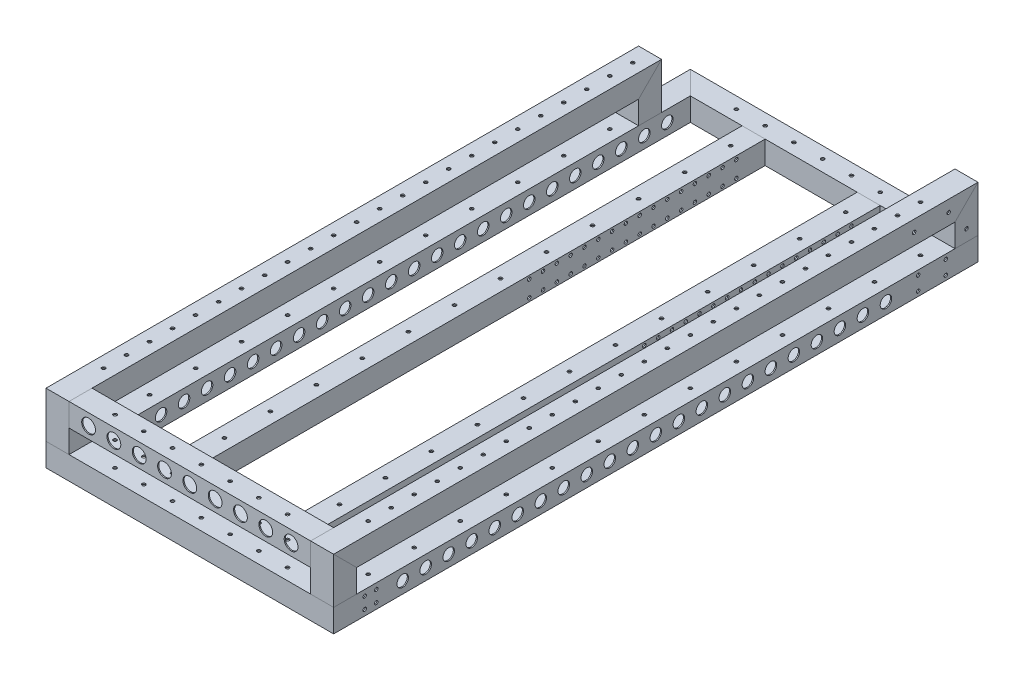
from build123d import *

# Parameters (mm, degrees)
WL_20X20X1_2_DEPTH         = 555.142135624
WL_20X20X1_2_DEPTH_BACK    = 15.142135624
SKETCH_12_W                = 20
SKETCH_12_H                = 20
SKETCH_12_W_2              = 18
SKETCH_12_H_2              = 18
SKETCH_12_ON_SEGMENT_2_W   = 20
SKETCH_12_ON_SEGMENT_2_H   = 20
SKETCH_12_ON_SEGMENT_2_W_2 = 18
SKETCH_12_ON_SEGMENT_2_H_2 = 18
WL_20X20X1_2_2_DEPTH       = 260.284271247
SKETCH_12_ON_SEGMENT_3_W   = 20
SKETCH_12_ON_SEGMENT_3_H   = 20
SKETCH_12_ON_SEGMENT_3_W_2 = 18
SKETCH_12_ON_SEGMENT_3_H_2 = 18
WL_20X20X1_2_3_DEPTH       = 570.284271247
SKETCH_12_ON_SEGMENT_4_W   = 20
SKETCH_12_ON_SEGMENT_4_H   = 20
SKETCH_12_ON_SEGMENT_4_W_2 = 18
SKETCH_12_ON_SEGMENT_4_H_2 = 18
WL_20X20X1_2_4_DEPTH       = 260.284271247
SKETCH_12_ON_SEGMENT_5_W   = 20
SKETCH_12_ON_SEGMENT_5_H   = 20
SKETCH_12_ON_SEGMENT_5_W_2 = 18
SKETCH_12_ON_SEGMENT_5_H_2 = 18
WL_20X20X1_2_5_DEPTH       = 542
SKETCH_12_ON_SEGMENT_6_W   = 20
SKETCH_12_ON_SEGMENT_6_H   = 20
SKETCH_12_ON_SEGMENT_6_W_2 = 18
SKETCH_12_ON_SEGMENT_6_H_2 = 18
WL_20X20X1_2_6_DEPTH       = 542
SKETCH_15_W                = 20
SKETCH_15_H                = 20
SKETCH_15_W_2              = 18
SKETCH_15_H_2              = 18
WL_20X20X1_4_DEPTH         = 45.142135624
SKETCH_15_ON_SEGMENT_2_W   = 20
SKETCH_15_ON_SEGMENT_2_H   = 20
SKETCH_15_ON_SEGMENT_2_W_2 = 18
SKETCH_15_ON_SEGMENT_2_H_2 = 18
WL_20X20X1_4_2_DEPTH       = 525.284271247
SKETCH_15_ON_SEGMENT_3_W   = 20
SKETCH_15_ON_SEGMENT_3_H   = 20
SKETCH_15_ON_SEGMENT_3_W_2 = 18
SKETCH_15_ON_SEGMENT_3_H_2 = 18
WL_20X20X1_4_3_DEPTH       = 45.142135624
SKETCH_15_ON_SEGMENT_4_W   = 20
SKETCH_15_ON_SEGMENT_4_H   = 20
SKETCH_15_ON_SEGMENT_4_W_2 = 18
SKETCH_15_ON_SEGMENT_4_H_2 = 18
WL_20X20X1_4_4_DEPTH       = 45.142135624
SKETCH_15_ON_SEGMENT_5_W   = 20
SKETCH_15_ON_SEGMENT_5_H   = 20
SKETCH_15_ON_SEGMENT_5_W_2 = 18
SKETCH_15_ON_SEGMENT_5_H_2 = 18
WL_20X20X1_4_5_DEPTH       = 570.284271247
SKETCH_15_ON_SEGMENT_6_W   = 20
SKETCH_15_ON_SEGMENT_6_H   = 20
SKETCH_15_ON_SEGMENT_6_W_2 = 18
SKETCH_15_ON_SEGMENT_6_H_2 = 18
WL_20X20X1_4_6_DEPTH       = 45.142135624
SKETCH_17_W                = 20
SKETCH_17_H                = 20
SKETCH_17_W_2              = 18
SKETCH_17_H_2              = 18
WL_20X20X1_5_DEPTH         = 210
SKETCH_18_R                = 1.5
CUT_EXTRUDE_1_DEPTH        = 20
SKETCH_19_R                = 1.5
CUT_EXTRUDE_2_DEPTH        = 20
SKETCH_20_R                = 1.5
CUT_EXTRUDE_3_DEPTH        = 20
SKETCH_21_R                = 1.5
CUT_EXTRUDE_4_DEPTH        = 120
SKETCH_22_R                = 5
CUT_EXTRUDE_5_DEPTH        = 20
SKETCH_23_R                = 5
CUT_EXTRUDE_6_DEPTH        = 20
SKETCH_24_R                = 6
CUT_EXTRUDE_7_DEPTH        = 20
SKETCH_25_R                = 1.5
CUT_EXTRUDE_8_DEPTH        = 20
SKETCH_27_R                = 1.5
CUT_EXTRUDE_9_DEPTH        = 20
SKETCH_28_R                = 1.5
CUT_EXTRUDE_10_DEPTH       = 313.449995999
SKETCH_29_R                = 1.5
CUT_EXTRUDE_11_DEPTH       = 20


with BuildPart() as part:
    # 草图12 → Wl 20X20X1(2) (new, two sides: drawn at the far end of the back side and taken through both)
    with BuildSketch(Plane(origin=(-115, 0, 270), x_dir=(-1, 0, 0), z_dir=(0, 0, -1)).offset(-WL_20X20X1_2_DEPTH_BACK)):
        Rectangle(SKETCH_12_W, SKETCH_12_H)
        Rectangle(SKETCH_12_W_2, SKETCH_12_H_2, mode=Mode.SUBTRACT)
    extrude(amount=WL_20X20X1_2_DEPTH + WL_20X20X1_2_DEPTH_BACK)

    # Wl 20X20X1(2) mitre 1
    split(bisect_by=Plane(origin=(-115, 0, 270), x_dir=(0, -1, 0), z_dir=(-0.707106781, 0, -0.707106781)), keep=Keep.TOP)

    # Wl 20X20X1(2) mitre 2
    split(bisect_by=Plane(origin=(-115, 0, -270), x_dir=(0, -1, 0), z_dir=(-0.707106781, 0, 0.707106781)), keep=Keep.TOP)

    # 草图20 → 切除-拉伸3 (cut)
    with BuildSketch(Plane.ZY.offset(125)):
        with Locations((243, 5)):
            Circle(SKETCH_20_R)
        with Locations((253, 5)):
            Circle(SKETCH_20_R)
        with Locations(Location((243, -5, 0), (0, 0, 180))):
            Circle(SKETCH_20_R)
        with Locations(Location((253, -5, 0), (0, 0, 180))):
            Circle(SKETCH_20_R)
    extrude(amount=-CUT_EXTRUDE_3_DEPTH, mode=Mode.SUBTRACT)

    # 草图23 → 切除-拉伸6 (cut)
    with BuildSketch(Plane.ZY.offset(125)):
        Circle(SKETCH_23_R)
        with Locations((-20, 0)):
            Circle(SKETCH_23_R)
        with Locations((-40, 0)):
            Circle(SKETCH_23_R)
        with Locations((-60, 0)):
            Circle(SKETCH_23_R)
        with Locations((-80, 0)):
            Circle(SKETCH_23_R)
        with Locations((-100, 0)):
            Circle(SKETCH_23_R)
        with Locations((-120, 0)):
            Circle(SKETCH_23_R)
        with Locations((-140, 0)):
            Circle(SKETCH_23_R)
        with Locations((-160, 0)):
            Circle(SKETCH_23_R)
        with Locations((-180, 0)):
            Circle(SKETCH_23_R)
        with Locations((-200, 0)):
            Circle(SKETCH_23_R)
        with Locations((-220, 0)):
            Circle(SKETCH_23_R)
        with Locations((-240, 0)):
            Circle(SKETCH_23_R)
        with Locations(Location((220, 0, 0), (0, 0, 180))):
            Circle(SKETCH_23_R)
        with Locations(Location((200, 0, 0), (0, 0, 180))):
            Circle(SKETCH_23_R)
        with Locations(Location((180, 0, 0), (0, 0, 180))):
            Circle(SKETCH_23_R)
        with Locations(Location((160, 0, 0), (0, 0, 180))):
            Circle(SKETCH_23_R)
        with Locations(Location((140, 0, 0), (0, 0, 180))):
            Circle(SKETCH_23_R)
        with Locations(Location((120, 0, 0), (0, 0, 180))):
            Circle(SKETCH_23_R)
        with Locations(Location((100, 0, 0), (0, 0, 180))):
            Circle(SKETCH_23_R)
        with Locations(Location((80, 0, 0), (0, 0, 180))):
            Circle(SKETCH_23_R)
        with Locations(Location((60, 0, 0), (0, 0, 180))):
            Circle(SKETCH_23_R)
        with Locations(Location((40, 0, 0), (0, 0, 180))):
            Circle(SKETCH_23_R)
        with Locations(Location((20, 0, 0), (0, 0, 180))):
            Circle(SKETCH_23_R)
    extrude(amount=-CUT_EXTRUDE_6_DEPTH, mode=Mode.SUBTRACT)


with BuildPart() as body_2:
    # 草图12 on segment 2 (carried to segment 2) → Wl 20X20X1_2 2 (new body)
    with BuildSketch(Plane(origin=(-130.142135624, 0, -270), x_dir=(0, 0, -1), z_dir=(1, 0, 0))):
        Rectangle(SKETCH_12_ON_SEGMENT_2_W, SKETCH_12_ON_SEGMENT_2_H)
        Rectangle(SKETCH_12_ON_SEGMENT_2_W_2, SKETCH_12_ON_SEGMENT_2_H_2, mode=Mode.SUBTRACT)
    extrude(amount=WL_20X20X1_2_2_DEPTH)

    # Wl 20X20X1_2 2 mitre 1
    split(bisect_by=Plane(origin=(-115, 0, -270), x_dir=(0, 1, 0), z_dir=(0.707106781, 0, -0.707106781)), keep=Keep.TOP)

    # Wl 20X20X1_2 2 mitre 2
    split(bisect_by=Plane(origin=(115, 0, -270), x_dir=(0, -1, 0), z_dir=(-0.707106781, 0, -0.707106781)), keep=Keep.TOP)


with BuildPart() as body_3:
    # 草图12 on segment 3 (carried to segment 3) → Wl 20X20X1_2 3 (new body)
    with BuildSketch(Plane(origin=(115, 0, -285.142135624), x_dir=(1, 0, 0), z_dir=(0, 0, 1))):
        Rectangle(SKETCH_12_ON_SEGMENT_3_W, SKETCH_12_ON_SEGMENT_3_H)
        Rectangle(SKETCH_12_ON_SEGMENT_3_W_2, SKETCH_12_ON_SEGMENT_3_H_2, mode=Mode.SUBTRACT)
    extrude(amount=WL_20X20X1_2_3_DEPTH)

    # Wl 20X20X1_2 3 mitre 1
    split(bisect_by=Plane(origin=(115, 0, 270), x_dir=(0, 1, 0), z_dir=(0.707106781, 0, -0.707106781)), keep=Keep.TOP)

    # Wl 20X20X1_2 3 mitre 2
    split(bisect_by=Plane(origin=(115, 0, -270), x_dir=(0, 1, 0), z_dir=(0.707106781, 0, 0.707106781)), keep=Keep.TOP)

    # 草图19 → 切除-拉伸2 (cut)
    with BuildSketch(Plane(origin=(125, 0, 0), x_dir=(0, 0, -1), z_dir=(1, 0, 0))):
        with Locations((-253, 5)):
            Circle(SKETCH_19_R)
        with Locations((-243, 5)):
            Circle(SKETCH_19_R)
        with Locations(Location((-243, -5, 0), (0, 0, 180))):
            Circle(SKETCH_19_R)
        with Locations(Location((-253, -5, 0), (0, 0, 180))):
            Circle(SKETCH_19_R)
    extrude(amount=-CUT_EXTRUDE_2_DEPTH, mode=Mode.SUBTRACT)

    # 草图22 → 切除-拉伸5 (cut)
    with BuildSketch(Plane(origin=(125, 0, 0), x_dir=(0, 0, -1), z_dir=(1, 0, 0))):
        Circle(SKETCH_22_R)
        with Locations((20, 0)):
            Circle(SKETCH_22_R)
        with Locations((40, 0)):
            Circle(SKETCH_22_R)
        with Locations((60, 0)):
            Circle(SKETCH_22_R)
        with Locations((80, 0)):
            Circle(SKETCH_22_R)
        with Locations((100, 0)):
            Circle(SKETCH_22_R)
        with Locations((120, 0)):
            Circle(SKETCH_22_R)
        with Locations((140, 0)):
            Circle(SKETCH_22_R)
        with Locations((160, 0)):
            Circle(SKETCH_22_R)
        with Locations((180, 0)):
            Circle(SKETCH_22_R)
        with Locations((200, 0)):
            Circle(SKETCH_22_R)
        with Locations(Location((-220, 0, 0), (0, 0, 180))):
            Circle(SKETCH_22_R)
        with Locations(Location((-200, 0, 0), (0, 0, 180))):
            Circle(SKETCH_22_R)
        with Locations(Location((-180, 0, 0), (0, 0, 180))):
            Circle(SKETCH_22_R)
        with Locations(Location((-160, 0, 0), (0, 0, 180))):
            Circle(SKETCH_22_R)
        with Locations(Location((-140, 0, 0), (0, 0, 180))):
            Circle(SKETCH_22_R)
        with Locations(Location((-120, 0, 0), (0, 0, 180))):
            Circle(SKETCH_22_R)
        with Locations(Location((-100, 0, 0), (0, 0, 180))):
            Circle(SKETCH_22_R)
        with Locations(Location((-80, 0, 0), (0, 0, 180))):
            Circle(SKETCH_22_R)
        with Locations(Location((-60, 0, 0), (0, 0, 180))):
            Circle(SKETCH_22_R)
        with Locations(Location((-40, 0, 0), (0, 0, 180))):
            Circle(SKETCH_22_R)
        with Locations(Location((-20, 0, 0), (0, 0, 180))):
            Circle(SKETCH_22_R)
    extrude(amount=-CUT_EXTRUDE_5_DEPTH, mode=Mode.SUBTRACT)

    # 草图27 → 切除-拉伸9 (cut)
    with BuildSketch(Plane(origin=(125, 0, 0), x_dir=(0, 0, -1), z_dir=(1, 0, 0))):
        with Locations((252, 6)):
            Circle(SKETCH_27_R)
        with Locations((228, 6)):
            Circle(SKETCH_27_R)
        with Locations(Location((228, -6, 0), (0, 0, 180))):
            Circle(SKETCH_27_R)
        with Locations(Location((252, -6, 0), (0, 0, 180))):
            Circle(SKETCH_27_R)
    extrude(amount=-CUT_EXTRUDE_9_DEPTH, mode=Mode.SUBTRACT)


with BuildPart() as body_4:
    # 草图12 on segment 4 (carried to segment 4) → Wl 20X20X1_2 4 (new body)
    with BuildSketch(Plane(origin=(130.142135624, 0, 270), x_dir=(0, 0, 1), z_dir=(-1, 0, 0))):
        Rectangle(SKETCH_12_ON_SEGMENT_4_W, SKETCH_12_ON_SEGMENT_4_H)
        Rectangle(SKETCH_12_ON_SEGMENT_4_W_2, SKETCH_12_ON_SEGMENT_4_H_2, mode=Mode.SUBTRACT)
    extrude(amount=WL_20X20X1_2_4_DEPTH)

    # Wl 20X20X1_2 4 mitre 1
    split(bisect_by=Plane(origin=(-115, 0, 270), x_dir=(0, 1, 0), z_dir=(0.707106781, 0, 0.707106781)), keep=Keep.TOP)

    # Wl 20X20X1_2 4 mitre 2
    split(bisect_by=Plane(origin=(115, 0, 270), x_dir=(0, -1, 0), z_dir=(-0.707106781, 0, 0.707106781)), keep=Keep.TOP)


with BuildPart() as body_5:
    # 草图12 on segment 5 (carried to segment 5) → Wl 20X20X1_2 5 (new body)
    with BuildSketch(Plane(origin=(-50, 0, -271), x_dir=(1, 0, 0), z_dir=(0, 0, 1))):
        Rectangle(SKETCH_12_ON_SEGMENT_5_W, SKETCH_12_ON_SEGMENT_5_H)
        Rectangle(SKETCH_12_ON_SEGMENT_5_W_2, SKETCH_12_ON_SEGMENT_5_H_2, mode=Mode.SUBTRACT)
    extrude(amount=WL_20X20X1_2_5_DEPTH)

    # Wl 20X20X1_2 5 mitre 1
    split(bisect_by=Plane(origin=(-50, 0, -260), x_dir=(0, -1, 0), z_dir=(0, 0, 1)), keep=Keep.TOP)

    # Wl 20X20X1_2 5 mitre 2
    split(bisect_by=Plane(origin=(-50, 0, 260), x_dir=(0, 1, 0), z_dir=(0, 0, -1)), keep=Keep.TOP)


with BuildPart() as body_6:
    # 草图12 on segment 6 (carried to segment 6) → Wl 20X20X1_2 6 (new body)
    with BuildSketch(Plane(origin=(50, 0, -271), x_dir=(1, 0, 0), z_dir=(0, 0, 1))):
        Rectangle(SKETCH_12_ON_SEGMENT_6_W, SKETCH_12_ON_SEGMENT_6_H)
        Rectangle(SKETCH_12_ON_SEGMENT_6_W_2, SKETCH_12_ON_SEGMENT_6_H_2, mode=Mode.SUBTRACT)
    extrude(amount=WL_20X20X1_2_6_DEPTH)

    # Wl 20X20X1_2 6 mitre 1
    split(bisect_by=Plane(origin=(50, 0, -260), x_dir=(0, -1, 0), z_dir=(0, 0, 1)), keep=Keep.TOP)

    # Wl 20X20X1_2 6 mitre 2
    split(bisect_by=Plane(origin=(50, 0, 260), x_dir=(0, 1, 0), z_dir=(0, 0, -1)), keep=Keep.TOP)


with BuildPart() as body_7:
    # 草图15 → Wl 20X20X1(4) (new body)
    with BuildSketch(Plane(origin=(-115, 10, 270), x_dir=(0, 0, 1), z_dir=(0, 1, 0))):
        Rectangle(SKETCH_15_W, SKETCH_15_H)
        Rectangle(SKETCH_15_W_2, SKETCH_15_H_2, mode=Mode.SUBTRACT)
    extrude(amount=WL_20X20X1_4_DEPTH)

    # Wl 20X20X1(4) mitre 1
    split(bisect_by=Plane(origin=(-115, 40, 270), x_dir=(1, 0, 0), z_dir=(0, -0.707106781, 0.707106781)), keep=Keep.TOP)


with BuildPart() as body_8:
    # 草图15 on segment 2 (carried to segment 2) → Wl 20X20X1_4 2 (new body)
    with BuildSketch(Plane(origin=(-115, 40, 285.142135624), x_dir=(0, 1, 0), z_dir=(0, 0, -1))):
        Rectangle(SKETCH_15_ON_SEGMENT_2_W, SKETCH_15_ON_SEGMENT_2_H)
        Rectangle(SKETCH_15_ON_SEGMENT_2_W_2, SKETCH_15_ON_SEGMENT_2_H_2, mode=Mode.SUBTRACT)
    extrude(amount=WL_20X20X1_4_2_DEPTH)

    # Wl 20X20X1_4 2 mitre 1
    split(bisect_by=Plane(origin=(-115, 40, -225), x_dir=(-1, 0, 0), z_dir=(0, 0.707106781, 0.707106781)), keep=Keep.TOP)

    # Wl 20X20X1_4 2 mitre 2
    split(bisect_by=Plane(origin=(-115, 40, 270), x_dir=(-1, 0, 0), z_dir=(0, 0.707106781, -0.707106781)), keep=Keep.TOP)


with BuildPart() as body_9:
    # 草图15 on segment 3 (carried to segment 3) → Wl 20X20X1_4 3 (new body)
    with BuildSketch(Plane(origin=(-115, 55.142135624, -225), x_dir=(0, 0, -1), z_dir=(0, -1, 0))):
        Rectangle(SKETCH_15_ON_SEGMENT_3_W, SKETCH_15_ON_SEGMENT_3_H)
        Rectangle(SKETCH_15_ON_SEGMENT_3_W_2, SKETCH_15_ON_SEGMENT_3_H_2, mode=Mode.SUBTRACT)
    extrude(amount=WL_20X20X1_4_3_DEPTH)

    # Wl 20X20X1_4 3 mitre 1
    split(bisect_by=Plane(origin=(-115, 40, -225), x_dir=(1, 0, 0), z_dir=(0, -0.707106781, -0.707106781)), keep=Keep.TOP)


with BuildPart() as body_10:
    # 草图15 on segment 4 (carried to segment 4) → Wl 20X20X1_4 4 (new body)
    with BuildSketch(Plane(origin=(115, 10, 270), x_dir=(0, 0, 1), z_dir=(0, 1, 0))):
        Rectangle(SKETCH_15_ON_SEGMENT_4_W, SKETCH_15_ON_SEGMENT_4_H)
        Rectangle(SKETCH_15_ON_SEGMENT_4_W_2, SKETCH_15_ON_SEGMENT_4_H_2, mode=Mode.SUBTRACT)
    extrude(amount=WL_20X20X1_4_4_DEPTH)

    # Wl 20X20X1_4 4 mitre 1
    split(bisect_by=Plane(origin=(115, 40, 270), x_dir=(1, 0, 0), z_dir=(0, -0.707106781, 0.707106781)), keep=Keep.TOP)


with BuildPart() as body_11:
    # 草图15 on segment 5 (carried to segment 5) → Wl 20X20X1_4 5 (new body)
    with BuildSketch(Plane(origin=(115, 40, -285.142135624), x_dir=(0, -1, 0), z_dir=(0, 0, 1))):
        Rectangle(SKETCH_15_ON_SEGMENT_5_W, SKETCH_15_ON_SEGMENT_5_H)
        Rectangle(SKETCH_15_ON_SEGMENT_5_W_2, SKETCH_15_ON_SEGMENT_5_H_2, mode=Mode.SUBTRACT)
    extrude(amount=WL_20X20X1_4_5_DEPTH)

    # Wl 20X20X1_4 5 mitre 1
    split(bisect_by=Plane(origin=(115, 40, -270), x_dir=(-1, 0, 0), z_dir=(0, 0.707106781, 0.707106781)), keep=Keep.TOP)

    # Wl 20X20X1_4 5 mitre 2
    split(bisect_by=Plane(origin=(115, 40, 270), x_dir=(-1, 0, 0), z_dir=(0, 0.707106781, -0.707106781)), keep=Keep.TOP)


with BuildPart() as body_12:
    # 草图15 on segment 6 (carried to segment 6) → Wl 20X20X1_4 6 (new body)
    with BuildSketch(Plane(origin=(115, 10, -270), x_dir=(0, 0, 1), z_dir=(0, 1, 0))):
        Rectangle(SKETCH_15_ON_SEGMENT_6_W, SKETCH_15_ON_SEGMENT_6_H)
        Rectangle(SKETCH_15_ON_SEGMENT_6_W_2, SKETCH_15_ON_SEGMENT_6_H_2, mode=Mode.SUBTRACT)
    extrude(amount=WL_20X20X1_4_6_DEPTH)

    # Wl 20X20X1_4 6 mitre 1
    split(bisect_by=Plane(origin=(115, 40, -270), x_dir=(1, 0, 0), z_dir=(0, -0.707106781, -0.707106781)), keep=Keep.TOP)


with BuildPart() as body_13:
    # 草图17 → Wl 20X20X1(5) (new body)
    with BuildSketch(Plane(origin=(-105, 40, 270), x_dir=(0, 0, -1), z_dir=(1, 0, 0))):
        Rectangle(SKETCH_17_W, SKETCH_17_H)
        Rectangle(SKETCH_17_W_2, SKETCH_17_H_2, mode=Mode.SUBTRACT)
    extrude(amount=WL_20X20X1_5_DEPTH)

    # 草图24 → 切除-拉伸7 (cut)
    with BuildSketch(Plane.XY.offset(280)):
        with Locations((0, 40)):
            Circle(SKETCH_24_R)
        with Locations((22, 40)):
            Circle(SKETCH_24_R)
        with Locations((44, 40)):
            Circle(SKETCH_24_R)
        with Locations((66, 40)):
            Circle(SKETCH_24_R)
        with Locations((88, 40)):
            Circle(SKETCH_24_R)
        with Locations((-88, 40)):
            Circle(SKETCH_24_R)
        with Locations((-66, 40)):
            Circle(SKETCH_24_R)
        with Locations((-44, 40)):
            Circle(SKETCH_24_R)
        with Locations((-22, 40)):
            Circle(SKETCH_24_R)
    extrude(amount=-CUT_EXTRUDE_7_DEPTH, mode=Mode.SUBTRACT)


with BuildPart() as cut_extrude_1_tool:
    # 草图18 → 切除-拉伸1 (new body)
    with BuildSketch(Plane(origin=(0, 50, 0), x_dir=(1, 0, 0), z_dir=(0, 1, 0))):
        with Locations(Location((115, -240, 0), (0, 0, 270))):
            Circle(SKETCH_18_R)
        with Locations(Location((115, -220, 0), (0, 0, 270))):
            Circle(SKETCH_18_R)
        with Locations(Location((115, -200, 0), (0, 0, 270))):
            Circle(SKETCH_18_R)
        with Locations(Location((115, -180, 0), (0, 0, 270))):
            Circle(SKETCH_18_R)
        with Locations(Location((115, -160, 0), (0, 0, 270))):
            Circle(SKETCH_18_R)
        with Locations(Location((115, -140, 0), (0, 0, 270))):
            Circle(SKETCH_18_R)
        with Locations(Location((115, -120, 0), (0, 0, 270))):
            Circle(SKETCH_18_R)
        with Locations(Location((115, -100, 0), (0, 0, 270))):
            Circle(SKETCH_18_R)
        with Locations(Location((115, -80, 0), (0, 0, 270))):
            Circle(SKETCH_18_R)
        with Locations(Location((115, -60, 0), (0, 0, 270))):
            Circle(SKETCH_18_R)
        with Locations(Location((115, -40, 0), (0, 0, 270))):
            Circle(SKETCH_18_R)
        with Locations(Location((115, -20, 0), (0, 0, 270))):
            Circle(SKETCH_18_R)
        with Locations(Location((115, 0, 0), (0, 0, 270))):
            Circle(SKETCH_18_R)
        with Locations(Location((115, 20, 0), (0, 0, 270))):
            Circle(SKETCH_18_R)
        with Locations(Location((115, 40, 0), (0, 0, 270))):
            Circle(SKETCH_18_R)
        with Locations(Location((115, 60, 0), (0, 0, 270))):
            Circle(SKETCH_18_R)
        with Locations(Location((115, 80, 0), (0, 0, 270))):
            Circle(SKETCH_18_R)
        with Locations(Location((115, 100, 0), (0, 0, 270))):
            Circle(SKETCH_18_R)
        with Locations(Location((115, 120, 0), (0, 0, 270))):
            Circle(SKETCH_18_R)
        with Locations(Location((115, 140, 0), (0, 0, 270))):
            Circle(SKETCH_18_R)
        with Locations(Location((115, 160, 0), (0, 0, 270))):
            Circle(SKETCH_18_R)
        with Locations(Location((115, 180, 0), (0, 0, 270))):
            Circle(SKETCH_18_R)
        with Locations(Location((115, 200, 0), (0, 0, 270))):
            Circle(SKETCH_18_R)
        with Locations(Location((115, 220, 0), (0, 0, 270))):
            Circle(SKETCH_18_R)
        with Locations(Location((115, 240, 0), (0, 0, 270))):
            Circle(SKETCH_18_R)
        with Locations((-115, 240)):
            Circle(SKETCH_18_R)
        with Locations(Location((-115, 220, 0), (0, 0, 90))):
            Circle(SKETCH_18_R)
        with Locations(Location((-115, 200, 0), (0, 0, 90))):
            Circle(SKETCH_18_R)
        with Locations(Location((-115, 180, 0), (0, 0, 90))):
            Circle(SKETCH_18_R)
        with Locations(Location((-115, 160, 0), (0, 0, 90))):
            Circle(SKETCH_18_R)
        with Locations(Location((-115, 140, 0), (0, 0, 90))):
            Circle(SKETCH_18_R)
        with Locations(Location((-115, 120, 0), (0, 0, 90))):
            Circle(SKETCH_18_R)
        with Locations(Location((-115, 100, 0), (0, 0, 90))):
            Circle(SKETCH_18_R)
        with Locations(Location((-115, 80, 0), (0, 0, 90))):
            Circle(SKETCH_18_R)
        with Locations(Location((-115, 60, 0), (0, 0, 90))):
            Circle(SKETCH_18_R)
        with Locations(Location((-115, 40, 0), (0, 0, 90))):
            Circle(SKETCH_18_R)
        with Locations(Location((-115, 20, 0), (0, 0, 90))):
            Circle(SKETCH_18_R)
        with Locations(Location((-115, 0, 0), (0, 0, 90))):
            Circle(SKETCH_18_R)
        with Locations(Location((-115, -20, 0), (0, 0, 90))):
            Circle(SKETCH_18_R)
        with Locations(Location((-115, -40, 0), (0, 0, 90))):
            Circle(SKETCH_18_R)
        with Locations(Location((-115, -60, 0), (0, 0, 90))):
            Circle(SKETCH_18_R)
        with Locations(Location((-115, -80, 0), (0, 0, 90))):
            Circle(SKETCH_18_R)
        with Locations(Location((-115, -100, 0), (0, 0, 90))):
            Circle(SKETCH_18_R)
        with Locations(Location((-115, -120, 0), (0, 0, 90))):
            Circle(SKETCH_18_R)
        with Locations(Location((-115, -140, 0), (0, 0, 90))):
            Circle(SKETCH_18_R)
        with Locations(Location((-115, -160, 0), (0, 0, 90))):
            Circle(SKETCH_18_R)
        with Locations(Location((-115, -180, 0), (0, 0, 90))):
            Circle(SKETCH_18_R)
        with Locations(Location((-115, -200, 0), (0, 0, 90))):
            Circle(SKETCH_18_R)
        with Locations(Location((-115, -220, 0), (0, 0, 90))):
            Circle(SKETCH_18_R)
        with Locations(Location((-115, -240, 0), (0, 0, 90))):
            Circle(SKETCH_18_R)
    extrude(amount=-CUT_EXTRUDE_1_DEPTH)


with BuildPart() as body_8_1:
    add(body_8.part)

    # 切除-拉伸1: cut by cut_extrude_1_tool
    add(cut_extrude_1_tool.part, mode=Mode.SUBTRACT)


with BuildPart() as body_11_1:
    add(body_11.part)

    # 切除-拉伸1: cut by cut_extrude_1_tool
    add(cut_extrude_1_tool.part, mode=Mode.SUBTRACT)


with BuildPart() as cut_extrude_4_tool:
    # 草图21 → 切除-拉伸4 (new body)
    with BuildSketch(Plane(origin=(60, 0, 0), x_dir=(0, 0, -1), z_dir=(1, 0, 0))):
        with Locations(Location((175, 7, 0), (0, 0, 180))):
            Circle(SKETCH_21_R)
        with Locations(Location((187, 7, 0), (0, 0, 180))):
            Circle(SKETCH_21_R)
        with Locations(Location((175, -7, 0), (0, 0, 180))):
            Circle(SKETCH_21_R)
        with Locations(Location((187, -7, 0), (0, 0, 180))):
            Circle(SKETCH_21_R)
        with Locations(Location((151, 7, 0), (0, 0, 180))):
            Circle(SKETCH_21_R)
        with Locations(Location((163, 7, 0), (0, 0, 180))):
            Circle(SKETCH_21_R)
        with Locations(Location((151, -7, 0), (0, 0, 180))):
            Circle(SKETCH_21_R)
        with Locations(Location((163, -7, 0), (0, 0, 180))):
            Circle(SKETCH_21_R)
        with Locations(Location((127, 7, 0), (0, 0, 180))):
            Circle(SKETCH_21_R)
        with Locations(Location((139, 7, 0), (0, 0, 180))):
            Circle(SKETCH_21_R)
        with Locations(Location((127, -7, 0), (0, 0, 180))):
            Circle(SKETCH_21_R)
        with Locations(Location((139, -7, 0), (0, 0, 180))):
            Circle(SKETCH_21_R)
        with Locations(Location((103, 7, 0), (0, 0, 180))):
            Circle(SKETCH_21_R)
        with Locations(Location((115, 7, 0), (0, 0, 180))):
            Circle(SKETCH_21_R)
        with Locations(Location((103, -7, 0), (0, 0, 180))):
            Circle(SKETCH_21_R)
        with Locations(Location((115, -7, 0), (0, 0, 180))):
            Circle(SKETCH_21_R)
        with Locations(Location((79, 7, 0), (0, 0, 180))):
            Circle(SKETCH_21_R)
        with Locations(Location((91, 7, 0), (0, 0, 180))):
            Circle(SKETCH_21_R)
        with Locations(Location((79, -7, 0), (0, 0, 180))):
            Circle(SKETCH_21_R)
        with Locations(Location((91, -7, 0), (0, 0, 180))):
            Circle(SKETCH_21_R)
        with Locations(Location((55, 7, 0), (0, 0, 180))):
            Circle(SKETCH_21_R)
        with Locations(Location((67, 7, 0), (0, 0, 180))):
            Circle(SKETCH_21_R)
        with Locations(Location((55, -7, 0), (0, 0, 180))):
            Circle(SKETCH_21_R)
        with Locations(Location((67, -7, 0), (0, 0, 180))):
            Circle(SKETCH_21_R)
        with Locations(Location((199, 7, 0), (0, 0, 180))):
            Circle(SKETCH_21_R)
        with Locations(Location((211, 7, 0), (0, 0, 180))):
            Circle(SKETCH_21_R)
        with Locations(Location((199, -7, 0), (0, 0, 180))):
            Circle(SKETCH_21_R)
        with Locations(Location((211, -7, 0), (0, 0, 180))):
            Circle(SKETCH_21_R)
        with Locations(Location((223, 7, 0), (0, 0, 180))):
            Circle(SKETCH_21_R)
        with Locations(Location((235, 7, 0), (0, 0, 180))):
            Circle(SKETCH_21_R)
        with Locations(Location((223, -7, 0), (0, 0, 180))):
            Circle(SKETCH_21_R)
        with Locations(Location((235, -7, 0), (0, 0, 180))):
            Circle(SKETCH_21_R)
    extrude(amount=-CUT_EXTRUDE_4_DEPTH)


with BuildPart() as body_5_1:
    add(body_5.part)

    # 切除-拉伸4: cut by cut_extrude_4_tool
    add(cut_extrude_4_tool.part, mode=Mode.SUBTRACT)


with BuildPart() as body_6_1:
    add(body_6.part)

    # 切除-拉伸4: cut by cut_extrude_4_tool
    add(cut_extrude_4_tool.part, mode=Mode.SUBTRACT)


with BuildPart() as cut_extrude_8_tool:
    # 草图25 → 切除-拉伸8 (new body)
    with BuildSketch(Plane(origin=(125, 0, 0), x_dir=(0, 0, -1), z_dir=(1, 0, 0))):
        with Locations((254.5, 40)):
            Circle(SKETCH_25_R)
        with Locations((270, 20)):
            Circle(SKETCH_25_R)
        with Locations((224.5, 40)):
            Circle(SKETCH_25_R)
    extrude(amount=-CUT_EXTRUDE_8_DEPTH)


with BuildPart() as body_11_2:
    add(body_11_1.part)

    # 切除-拉伸8: cut by cut_extrude_8_tool
    add(cut_extrude_8_tool.part, mode=Mode.SUBTRACT)


with BuildPart() as body_12_1:
    add(body_12.part)

    # 切除-拉伸8: cut by cut_extrude_8_tool
    add(cut_extrude_8_tool.part, mode=Mode.SUBTRACT)


with BuildPart() as cut_extrude_10_tool:
    # 草图28 → 切除-拉伸10 (new, through all)
    with BuildSketch(Plane(origin=(0, 50, 0), x_dir=(1, 0, 0), z_dir=(0, 1, 0))):
        with Locations(Location((0, -270, 0), (0, 0, 270))):
            Circle(SKETCH_28_R)
        with Locations(Location((25, -270, 0), (0, 0, 270))):
            Circle(SKETCH_28_R)
        with Locations(Location((50, -270, 0), (0, 0, 270))):
            Circle(SKETCH_28_R)
        with Locations(Location((75, -270, 0), (0, 0, 270))):
            Circle(SKETCH_28_R)
        with Locations(Location((-75, -270, 0), (0, 0, 270))):
            Circle(SKETCH_28_R)
        with Locations(Location((-50, -270, 0), (0, 0, 270))):
            Circle(SKETCH_28_R)
        with Locations(Location((-25, -270, 0), (0, 0, 270))):
            Circle(SKETCH_28_R)
    extrude(amount=-CUT_EXTRUDE_10_DEPTH)


with BuildPart() as body_4_1:
    add(body_4.part)

    # 切除-拉伸10: cut by cut_extrude_10_tool
    add(cut_extrude_10_tool.part, mode=Mode.SUBTRACT)


with BuildPart() as body_13_1:
    add(body_13.part)

    # 切除-拉伸10: cut by cut_extrude_10_tool
    add(cut_extrude_10_tool.part, mode=Mode.SUBTRACT)


with BuildPart() as cut_extrude_11_tool:
    # 草图29 → 切除-拉伸11 (new body)
    with BuildSketch(Plane.XZ.offset(10)):
        with Locations(Location((50, 0, 0), (0, 0, 270))):
            Circle(SKETCH_29_R)
        with Locations(Location((50, 40, 0), (0, 0, 270))):
            Circle(SKETCH_29_R)
        with Locations(Location((50, 80, 0), (0, 0, 270))):
            Circle(SKETCH_29_R)
        with Locations(Location((50, 120, 0), (0, 0, 270))):
            Circle(SKETCH_29_R)
        with Locations(Location((50, 160, 0), (0, 0, 270))):
            Circle(SKETCH_29_R)
        with Locations(Location((50, 200, 0), (0, 0, 270))):
            Circle(SKETCH_29_R)
        with Locations(Location((50, 240, 0), (0, 0, 270))):
            Circle(SKETCH_29_R)
        with Locations(Location((50, -240, 0), (0, 0, 90))):
            Circle(SKETCH_29_R)
        with Locations(Location((50, -200, 0), (0, 0, 90))):
            Circle(SKETCH_29_R)
        with Locations(Location((50, -160, 0), (0, 0, 90))):
            Circle(SKETCH_29_R)
        with Locations(Location((50, -120, 0), (0, 0, 90))):
            Circle(SKETCH_29_R)
        with Locations(Location((50, -80, 0), (0, 0, 90))):
            Circle(SKETCH_29_R)
        with Locations(Location((50, -40, 0), (0, 0, 90))):
            Circle(SKETCH_29_R)
        with Locations(Location((-50, -40, 0), (0, 0, 270))):
            Circle(SKETCH_29_R)
        with Locations(Location((-50, -80, 0), (0, 0, 270))):
            Circle(SKETCH_29_R)
        with Locations(Location((-50, -120, 0), (0, 0, 270))):
            Circle(SKETCH_29_R)
        with Locations(Location((-50, -160, 0), (0, 0, 270))):
            Circle(SKETCH_29_R)
        with Locations(Location((-50, -200, 0), (0, 0, 270))):
            Circle(SKETCH_29_R)
        with Locations(Location((-50, -240, 0), (0, 0, 270))):
            Circle(SKETCH_29_R)
        with Locations(Location((-50, 240, 0), (0, 0, 90))):
            Circle(SKETCH_29_R)
        with Locations(Location((-50, 200, 0), (0, 0, 90))):
            Circle(SKETCH_29_R)
        with Locations(Location((-50, 160, 0), (0, 0, 90))):
            Circle(SKETCH_29_R)
        with Locations(Location((-50, 120, 0), (0, 0, 90))):
            Circle(SKETCH_29_R)
        with Locations(Location((-50, 80, 0), (0, 0, 90))):
            Circle(SKETCH_29_R)
        with Locations(Location((-50, 40, 0), (0, 0, 90))):
            Circle(SKETCH_29_R)
        with Locations(Location((-50, 0, 0), (0, 0, 90))):
            Circle(SKETCH_29_R)
        with Locations(Location((75, 270, 0), (0, 0, 90))):
            Circle(SKETCH_29_R)
        with Locations(Location((50, 270, 0), (0, 0, 90))):
            Circle(SKETCH_29_R)
        with Locations(Location((25, 270, 0), (0, 0, 90))):
            Circle(SKETCH_29_R)
        with Locations(Location((0, 270, 0), (0, 0, 90))):
            Circle(SKETCH_29_R)
        with Locations(Location((-25, 270, 0), (0, 0, 90))):
            Circle(SKETCH_29_R)
        with Locations(Location((-50, 270, 0), (0, 0, 90))):
            Circle(SKETCH_29_R)
        with Locations(Location((-75, 270, 0), (0, 0, 90))):
            Circle(SKETCH_29_R)
        with Locations(Location((-75, -270, 0), (0, 0, 90))):
            Circle(SKETCH_29_R)
        with Locations(Location((-50, -270, 0), (0, 0, 90))):
            Circle(SKETCH_29_R)
        with Locations(Location((-25, -270, 0), (0, 0, 90))):
            Circle(SKETCH_29_R)
        with Locations(Location((0, -270, 0), (0, 0, 90))):
            Circle(SKETCH_29_R)
        with Locations(Location((25, -270, 0), (0, 0, 90))):
            Circle(SKETCH_29_R)
        with Locations(Location((50, -270, 0), (0, 0, 90))):
            Circle(SKETCH_29_R)
        with Locations(Location((75, -270, 0), (0, 0, 90))):
            Circle(SKETCH_29_R)
        with Locations(Location((115, -40, 0), (0, 0, 90))):
            Circle(SKETCH_29_R)
        with Locations(Location((115, -80, 0), (0, 0, 90))):
            Circle(SKETCH_29_R)
        with Locations(Location((115, -120, 0), (0, 0, 90))):
            Circle(SKETCH_29_R)
        with Locations(Location((115, -160, 0), (0, 0, 90))):
            Circle(SKETCH_29_R)
        with Locations(Location((115, -200, 0), (0, 0, 90))):
            Circle(SKETCH_29_R)
        with Locations(Location((115, -240, 0), (0, 0, 90))):
            Circle(SKETCH_29_R)
        with Locations(Location((115, 240, 0), (0, 0, 90))):
            Circle(SKETCH_29_R)
        with Locations(Location((115, 200, 0), (0, 0, 90))):
            Circle(SKETCH_29_R)
        with Locations(Location((115, 160, 0), (0, 0, 90))):
            Circle(SKETCH_29_R)
        with Locations(Location((115, 120, 0), (0, 0, 90))):
            Circle(SKETCH_29_R)
        with Locations(Location((115, 80, 0), (0, 0, 90))):
            Circle(SKETCH_29_R)
        with Locations(Location((115, 40, 0), (0, 0, 90))):
            Circle(SKETCH_29_R)
        with Locations(Location((115, 0, 0), (0, 0, 90))):
            Circle(SKETCH_29_R)
        with Locations(Location((-115, 0, 0), (0, 0, 270))):
            Circle(SKETCH_29_R)
        with Locations(Location((-115, 40, 0), (0, 0, 270))):
            Circle(SKETCH_29_R)
        with Locations(Location((-115, 80, 0), (0, 0, 270))):
            Circle(SKETCH_29_R)
        with Locations(Location((-115, 120, 0), (0, 0, 270))):
            Circle(SKETCH_29_R)
        with Locations(Location((-115, 160, 0), (0, 0, 270))):
            Circle(SKETCH_29_R)
        with Locations(Location((-115, 200, 0), (0, 0, 270))):
            Circle(SKETCH_29_R)
        with Locations(Location((-115, 240, 0), (0, 0, 270))):
            Circle(SKETCH_29_R)
        with Locations(Location((-115, -240, 0), (0, 0, 90))):
            Circle(SKETCH_29_R)
        with Locations(Location((-115, -200, 0), (0, 0, 270))):
            Circle(SKETCH_29_R)
        with Locations(Location((-115, -160, 0), (0, 0, 270))):
            Circle(SKETCH_29_R)
        with Locations(Location((-115, -120, 0), (0, 0, 270))):
            Circle(SKETCH_29_R)
        with Locations(Location((-115, -80, 0), (0, 0, 270))):
            Circle(SKETCH_29_R)
        with Locations(Location((-115, -40, 0), (0, 0, 270))):
            Circle(SKETCH_29_R)
    extrude(amount=-CUT_EXTRUDE_11_DEPTH)


with BuildPart() as part_1:
    add(part.part)

    # 切除-拉伸11: cut by cut_extrude_11_tool
    add(cut_extrude_11_tool.part, mode=Mode.SUBTRACT)


with BuildPart() as body_2_1:
    add(body_2.part)

    # 切除-拉伸11: cut by cut_extrude_11_tool
    add(cut_extrude_11_tool.part, mode=Mode.SUBTRACT)


with BuildPart() as body_3_1:
    add(body_3.part)

    # 切除-拉伸11: cut by cut_extrude_11_tool
    add(cut_extrude_11_tool.part, mode=Mode.SUBTRACT)


with BuildPart() as body_5_2:
    add(body_5_1.part)

    # 切除-拉伸11: cut by cut_extrude_11_tool
    add(cut_extrude_11_tool.part, mode=Mode.SUBTRACT)


with BuildPart() as body_6_2:
    add(body_6_1.part)

    # 切除-拉伸11: cut by cut_extrude_11_tool
    add(cut_extrude_11_tool.part, mode=Mode.SUBTRACT)


solid = Compound([body_7.part, body_9.part, body_10.part, body_8_1.part, body_11_2.part, body_12_1.part, body_4_1.part, body_13_1.part, part_1.part, body_2_1.part, body_3_1.part, body_5_2.part, body_6_2.part])
